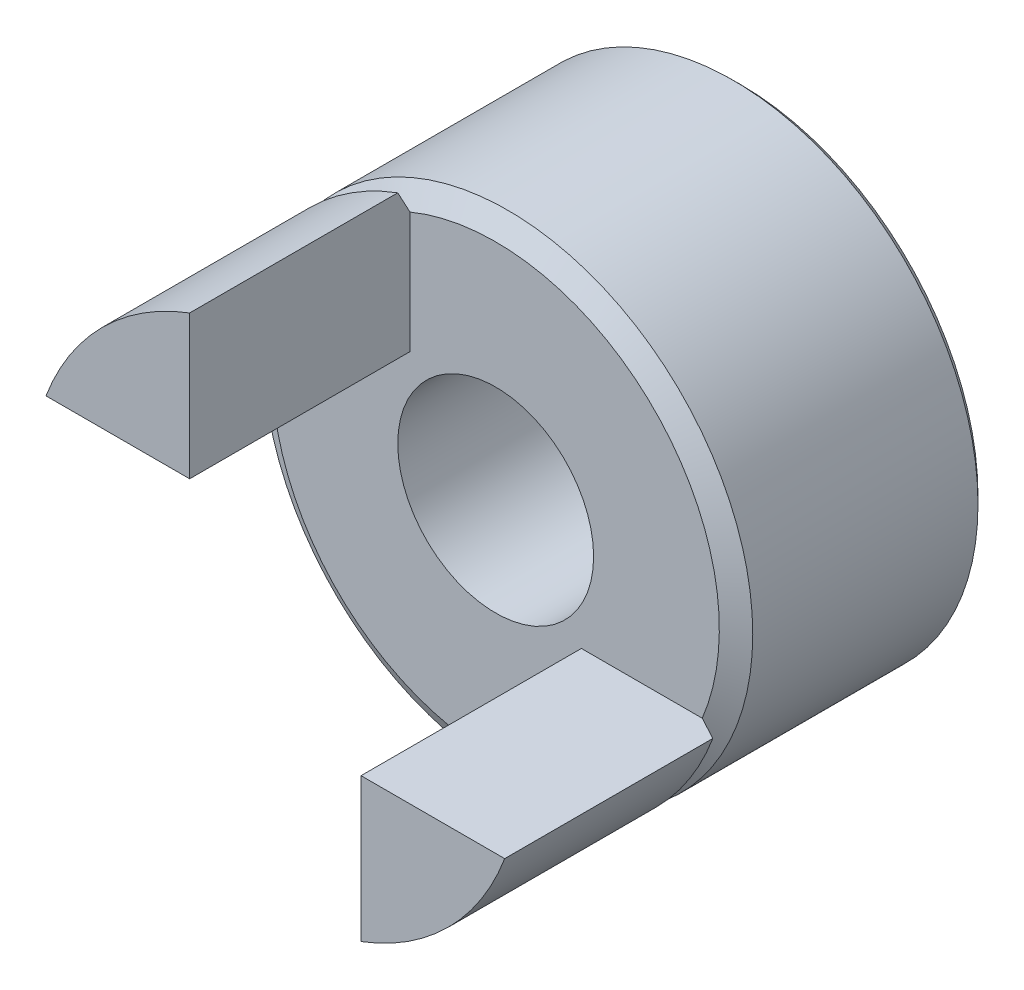
from build123d import *

# Parameters (mm, degrees)
SKETCH_1_R      = 10
SKETCH_1_R_2    = 4
EXTRUDE_1_DEPTH = 10
CHAMFER_1_SIZE  = 0.3
EXTRUDE_2_DEPTH = 9


with BuildPart() as part:
    # 스케치1 → 보스-돌출1 (new body)
    with BuildSketch(Plane.XY):
        Circle(SKETCH_1_R)
        Circle(SKETCH_1_R_2, mode=Mode.SUBTRACT)
    extrude(amount=EXTRUDE_1_DEPTH)

    # 모따기1
    chamfer_1_edges = [part.edges().sort_by_distance(p)[0] for p in [
        (-4, 0, 0),
        (-10, 0, 0),
    ]]
    chamfer(chamfer_1_edges, length=CHAMFER_1_SIZE)

    # 스케치2 → 보스-돌출2 (add)
    with BuildSketch(Plane.XY.offset(10)):
        with BuildLine():
            ThreePointArc((-3.5, 9.367496998), (-7.071067812, 7.071067812), (-9.367496998, 3.5))
            Line((-9.367496998, 3.5), (-3.5, 3.5))
            Line((-3.5, 3.5), (-3.5, 9.367496998))
        make_face()
        with BuildLine():
            Line((9.367496998, -3.5), (3.5, -3.5))
            Line((3.5, -3.5), (3.5, -9.367496998))
            ThreePointArc((3.5, -9.367496998), (7.071067812, -7.071067812), (9.367496998, -3.5))
        make_face()
    extrude(amount=EXTRUDE_2_DEPTH)

    # 스케치3 → 컷-회전1 (revolve, cut)
    with BuildSketch(Plane(origin=(0, 0, 0), x_dir=(1, 0, 0), z_dir=(0, 1, 0))):
        Polygon((9.133974596, -10), (10, -10.5), (10, -9.5), align=None)
    revolve(axis=Axis((0, 0, 0), (0, 0, 1)), mode=Mode.SUBTRACT)


solid = part.part
